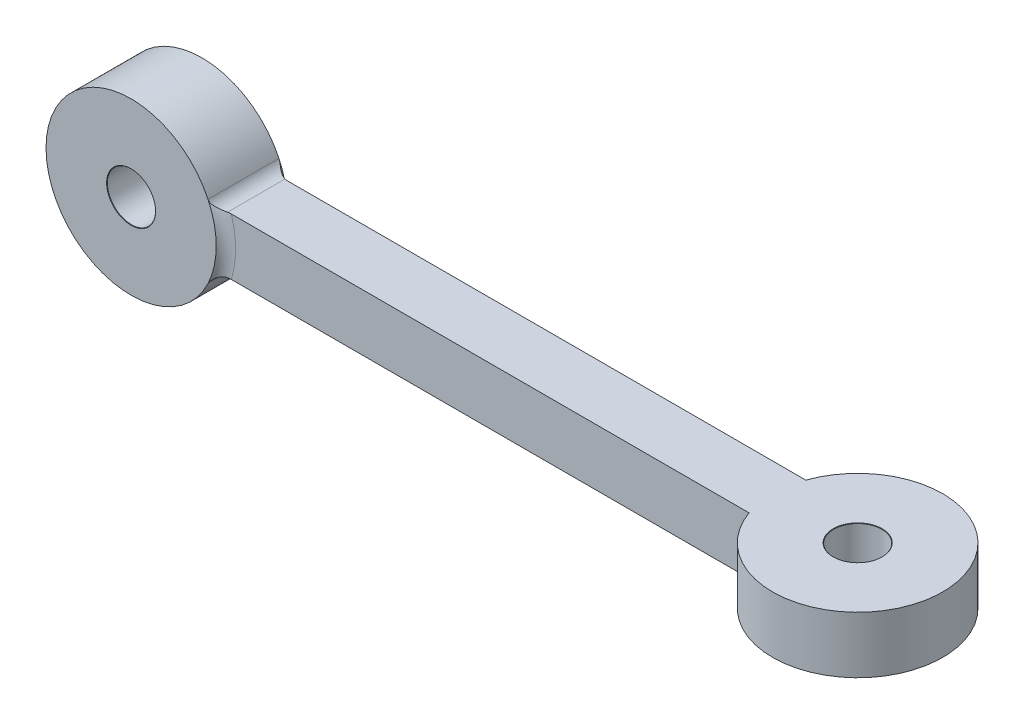
from build123d import *

# Parameters (mm, degrees)
BOSS_EXTRUDE10_DEPTH           = 2.5
BOSS_EXTRUDE10_DEPTH_BACK      = 2.5
SKETCH7_R                      = 6
BOSS_EXTRUDE11_DEPTH           = 2
BOSS_EXTRUDE11_DEPTH_BACK      = 2
FILLET4_R                      = 1
M3_CLEARANCE_HOLE1_D           = 3.4
M3_CLEARANCE_HOLE1_CSINK_D     = 3.45
M3_CLEARANCE_HOLE1_CSINK_ANGLE = 90
M3_CLEARANCE_HOLE2_D           = 3.4
M3_CLEARANCE_HOLE2_CSINK_D     = 3.45
M3_CLEARANCE_HOLE2_CSINK_ANGLE = 90


with BuildPart() as part:
    # Sketch7 → Boss-Extrude10 (new, two sides: drawn at the far end of the back side and taken through both)
    with BuildSketch(Plane.XY.offset(-2).offset(-BOSS_EXTRUDE10_DEPTH_BACK)):
        with Locations((-3, 0)):
            Circle(SKETCH7_R)
    extrude(amount=BOSS_EXTRUDE10_DEPTH + BOSS_EXTRUDE10_DEPTH_BACK)

    # Sketch4 → Boss-Extrude11 (add, two sides: drawn at the far end of the back side and taken through both)
    with BuildSketch(Plane(origin=(0, 0, 0), x_dir=(1, 0, 0), z_dir=(0, 1, 0)).offset(-BOSS_EXTRUDE11_DEPTH_BACK)):
        with BuildLine():
            ThreePointArc((40.062693756, 4), (39.719548005, 2), (40.062693756, 0))
            Line((40.062693756, 0), (45.719548005, 0))
            Line((45.719548005, 0), (45.719548005, 4))
            Line((45.719548005, 4), (40.062693756, 4))
        make_face()
        with BuildLine():
            Line((45.719548005, 0), (40.062693756, 0))
            ThreePointArc((40.062693756, 0), (46.734159878, -3.913591358), (51.719548005, 2))
            ThreePointArc((51.719548005, 2), (46.734159878, 7.913591358), (40.062693756, 4))
            Line((40.062693756, 4), (45.719548005, 4))
            Line((45.719548005, 4), (45.719548005, 0))
        make_face()
        with BuildLine():
            Line((0, 4), (0, 0))
            Line((0, 0), (40.062693756, 0))
            ThreePointArc((40.062693756, 0), (39.719548005, 2), (40.062693756, 4))
            Line((40.062693756, 4), (0, 4))
        make_face()
    extrude(amount=BOSS_EXTRUDE11_DEPTH + BOSS_EXTRUDE11_DEPTH_BACK)

    # Fillet4
    # the kernel refuses this fillet: 1 mm, written as the material it adds along each edge
    with BuildSketch(Plane(origin=(2.656854249, 2, 0), x_dir=(-0.381458859418171, 0.9243858169462511, 1.7363680755605478e-15), z_dir=(0, 0, -1)), Plane(origin=(2.656854249, -2, -4), x_dir=(-0.3814588594181449, -0.924385816946262, 1.7363680755604279e-15), z_dir=(0, 0, 1))) as fillet4_piece_1:
        with BuildLine():
            CenterArc((0.669685328, 0.998672259), FILLET4_R, 202.42407708, 64.623066475)
            Line((-0.254700489, 0.6172134), (-0.273188205, 0.609584223))
            Line((-0.273188205, 0.609584223), (-0.018487716, -0.007629177))
            Line((-0.018487716, -0.007629177), (0.001030285, -0.019973445))
            ThreePointArc((0.001030285, -0.019973445), (0.309085536, -0.012033556), (0.617140787, -0.019973445))
            Line((0.617140787, -0.019973445), (0.618171072, 0))
        make_face()
    extrude(amount=4)
    with BuildSketch(Plane(origin=(-3, 0, -4), x_dir=(0.764399035602867, -0.6447434484889372, 0), z_dir=(-0.6447434484889372, -0.764399035602867, 0))) as fillet4_piece_2_section:
        with BuildLine():
            CenterArc((6.866025404, -1), FILLET4_R, 90, 60)
            Line((6.866025404, 0), (6.866025404, 0.02))
            Line((6.866025404, 0.02), (6, 0.02))
            Line((6, 0.02), (5.98, 0))
            ThreePointArc((5.98, 0), (5.98, -0.25), (5.982679492, -0.49))
            Line((5.982679492, -0.49), (6, -0.5))
        make_face()
    fillet4_piece_2 = revolve(axis=Axis((-3, 0, -4), (0, 0, 1)), revolution_arc=40.146442844, mode=Mode.PRIVATE)
    fillet4_piece_2 = split(fillet4_piece_2, bisect_by=Plane(origin=(3.105396532, -2, -4.129597007), z_dir=(0, 1, 0)), keep=Keep.TOP, mode=Mode.PRIVATE)
    add(fillet4_piece_2)
    with BuildSketch(Plane(origin=(-3, 0, 0), x_dir=(0.7643990356028665, 0.6447434484889378, 0), z_dir=(-0.6447434484889378, 0.7643990356028665, 0))) as fillet4_piece_3_section:
        with BuildLine():
            CenterArc((6.866025404, -1), FILLET4_R, 90, 60)
            Line((6.866025404, 0), (6.866025404, 0.02))
            Line((6.866025404, 0.02), (6, 0.02))
            Line((6, 0.02), (5.98, 0))
            ThreePointArc((5.98, 0), (5.98, -0.25), (5.982679492, -0.49))
            Line((5.982679492, -0.49), (6, -0.5))
        make_face()
    fillet4_piece_3 = revolve(axis=Axis((-3, 0, 0), (0, 0, -1)), revolution_arc=40.146442844, mode=Mode.PRIVATE)
    fillet4_piece_3 = split(fillet4_piece_3, bisect_by=Plane(origin=(3.105396532, 2, 0.129597007), z_dir=(0, -1, 0)), keep=Keep.TOP, mode=Mode.PRIVATE)
    add(fillet4_piece_3)
    with BuildSketch(Plane(origin=(-3, 0, 0), x_dir=(1, 0, 0), z_dir=(0, 1, 0))) as fillet4_piece_4_section:
        with BuildLine():
            CenterArc((6.866025404, -1), FILLET4_R, 90, 60)
            Line((6.866025404, 0), (6.866025404, 0.02))
            Line((6.866025404, 0.02), (6, 0.02))
            Line((6, 0.02), (5.98, 0))
            ThreePointArc((5.98, 0), (5.98, -0.25), (5.982679492, -0.49))
            Line((5.982679492, -0.49), (6, -0.5))
        make_face()
    fillet4_piece_4 = revolve(axis=Axis((-3, 0, 0), (0, 0, -1)), revolution_arc=40.146442844, mode=Mode.PRIVATE)
    fillet4_piece_4 = split(fillet4_piece_4, bisect_by=Plane(origin=(3.105396981, -2, 0.129596926), z_dir=(0, 1, 0)), keep=Keep.TOP, mode=Mode.PRIVATE)
    add(fillet4_piece_4)
    with BuildSketch(Plane(origin=(-3, 0, -4), x_dir=(1, 0, 0), z_dir=(0, -1, 0))) as fillet4_piece_5_section:
        with BuildLine():
            CenterArc((6.866025404, -1), FILLET4_R, 90, 60)
            Line((6.866025404, 0), (6.866025404, 0.02))
            Line((6.866025404, 0.02), (6, 0.02))
            Line((6, 0.02), (5.98, 0))
            ThreePointArc((5.98, 0), (5.98, -0.25), (5.982679492, -0.49))
            Line((5.982679492, -0.49), (6, -0.5))
        make_face()
    fillet4_piece_5 = revolve(axis=Axis((-3, 0, -4), (0, 0, 1)), revolution_arc=40.146442844, mode=Mode.PRIVATE)
    fillet4_piece_5 = split(fillet4_piece_5, bisect_by=Plane(origin=(3.105396981, 2, -4.129596926), z_dir=(0, -1, 0)), keep=Keep.TOP, mode=Mode.PRIVATE)
    add(fillet4_piece_5)
    with BuildSketch(Plane(origin=(-3, 0, 0), x_dir=(0.7643990356028665, 0.6447434484889378, 0), z_dir=(-0.6447434484889378, 0.7643990356028665, 0))) as fillet4_piece_6a_section:
        with BuildLine():
            CenterArc((6.866025404, -1), FILLET4_R, 90, 60)
            Line((6.866025404, 0), (6.866025404, 0.02))
            Line((6.866025404, 0.02), (6, 0.02))
            Line((6, 0.02), (5.98, 0))
            ThreePointArc((5.98, 0), (5.98, -0.25), (5.982679492, -0.49))
            Line((5.982679492, -0.49), (6, -0.5))
        make_face()
    fillet4_piece_6a = revolve(axis=Axis((-3, 0, 0), (0, 0, -1)), revolution_arc=40.146442844, mode=Mode.PRIVATE)
    fillet4_piece_6a = split(fillet4_piece_6a, bisect_by=Plane(origin=(2.392166005, 2, 0.125287607), z_dir=(0, 1, 0)), keep=Keep.TOP, mode=Mode.PRIVATE)
    with BuildSketch(Plane(origin=(2.656854249, 2, 1.669252677), x_dir=(-0.38145885941817037, 0.9243858169462514, 1.7363680755605446e-15), z_dir=(0, 0, -1))) as fillet4_piece_6b_section:
        with BuildLine():
            CenterArc((0.669685328, 0.998672259), FILLET4_R, 202.42407708, 64.623066475)
            Line((-0.254700489, 0.6172134), (-0.273188205, 0.609584223))
            Line((-0.273188205, 0.609584223), (-0.018487716, -0.007629177))
            Line((-0.018487716, -0.007629177), (0.001030285, -0.019973445))
            ThreePointArc((0.001030285, -0.019973445), (0.309085536, -0.012033556), (0.617140787, -0.019973445))
            Line((0.617140787, -0.019973445), (0.618171072, 0))
        make_face()
    fillet4_piece_6b = extrude(amount=5.669252677, mode=Mode.PRIVATE)
    fillet4_piece_6b = split(fillet4_piece_6b, bisect_by=Plane(origin=(2.758670991, 2.124773094, 0.5), z_dir=(0, 0, -1)), keep=Keep.TOP, mode=Mode.PRIVATE)
    fillet4_piece_6b = split(fillet4_piece_6b, bisect_by=Plane(origin=(2.758670991, 2.124773094, 0), z_dir=(0, 0, 1)), keep=Keep.TOP, mode=Mode.PRIVATE)
    fillet4_piece_6 = fillet4_piece_6a & fillet4_piece_6b
    add(fillet4_piece_6)
    with BuildSketch(Plane(origin=(-3, 0, -4), x_dir=(1, 0, 0), z_dir=(0, -1, 0))) as fillet4_piece_7a_section:
        with BuildLine():
            CenterArc((6.866025404, -1), FILLET4_R, 90, 60)
            Line((6.866025404, 0), (6.866025404, 0.02))
            Line((6.866025404, 0.02), (6, 0.02))
            Line((6, 0.02), (5.98, 0))
            ThreePointArc((5.98, 0), (5.98, -0.25), (5.982679492, -0.49))
            Line((5.982679492, -0.49), (6, -0.5))
        make_face()
    fillet4_piece_7a = revolve(axis=Axis((-3, 0, -4), (0, 0, 1)), revolution_arc=40.146442844, mode=Mode.PRIVATE)
    fillet4_piece_7a = split(fillet4_piece_7a, bisect_by=Plane(origin=(2.392165487, 2, -4.125287706), z_dir=(0, 1, 0)), keep=Keep.TOP, mode=Mode.PRIVATE)
    with BuildSketch(Plane(origin=(2.656854249, 2, 0), x_dir=(-0.381458859418171, 0.9243858169462511, 1.7363680755605478e-15), z_dir=(0, 0, -1))) as fillet4_piece_7b_section:
        with BuildLine():
            CenterArc((0.669685328, 0.998672259), FILLET4_R, 202.42407708, 64.623066475)
            Line((-0.254700489, 0.6172134), (-0.273188205, 0.609584223))
            Line((-0.273188205, 0.609584223), (-0.018487716, -0.007629177))
            Line((-0.018487716, -0.007629177), (0.001030285, -0.019973445))
            ThreePointArc((0.001030285, -0.019973445), (0.309085536, -0.012033556), (0.617140787, -0.019973445))
            Line((0.617140787, -0.019973445), (0.618171072, 0))
        make_face()
    fillet4_piece_7b = extrude(amount=5.669252677, mode=Mode.PRIVATE)
    fillet4_piece_7b = split(fillet4_piece_7b, bisect_by=Plane(origin=(2.758670991, 2.124773094, -4.5), z_dir=(0, 0, 1)), keep=Keep.TOP, mode=Mode.PRIVATE)
    fillet4_piece_7b = split(fillet4_piece_7b, bisect_by=Plane(origin=(2.758670991, 2.124773094, -4), z_dir=(0, 0, -1)), keep=Keep.TOP, mode=Mode.PRIVATE)
    fillet4_piece_7 = fillet4_piece_7a & fillet4_piece_7b
    add(fillet4_piece_7)
    with BuildSketch(Plane(origin=(2.656854249, -2, -5.669252677), x_dir=(-0.38145885941816965, -0.9243858169462517, 1.7363680755605413e-15), z_dir=(0, 0, 1))) as fillet4_piece_8a_section:
        with BuildLine():
            CenterArc((0.669685328, 0.998672259), FILLET4_R, 202.42407708, 64.623066475)
            Line((-0.254700489, 0.6172134), (-0.273188205, 0.609584223))
            Line((-0.273188205, 0.609584223), (-0.018487716, -0.007629177))
            Line((-0.018487716, -0.007629177), (0.001030285, -0.019973445))
            ThreePointArc((0.001030285, -0.019973445), (0.309085536, -0.012033556), (0.617140787, -0.019973445))
            Line((0.617140787, -0.019973445), (0.618171072, 0))
        make_face()
    fillet4_piece_8a = extrude(amount=5.669252677, mode=Mode.PRIVATE)
    fillet4_piece_8a = split(fillet4_piece_8a, bisect_by=Plane(origin=(2.758670991, -2.124773094, -4.5), z_dir=(0, 0, 1)), keep=Keep.TOP, mode=Mode.PRIVATE)
    fillet4_piece_8a = split(fillet4_piece_8a, bisect_by=Plane(origin=(2.758670991, -2.124773094, -4), z_dir=(0, 0, -1)), keep=Keep.TOP, mode=Mode.PRIVATE)
    with BuildSketch(Plane(origin=(-3, 0, -4), x_dir=(0.764399035602867, -0.6447434484889372, 0), z_dir=(-0.6447434484889372, -0.764399035602867, 0))) as fillet4_piece_8b_section:
        with BuildLine():
            CenterArc((6.866025404, -1), FILLET4_R, 90, 60)
            Line((6.866025404, 0), (6.866025404, 0.02))
            Line((6.866025404, 0.02), (6, 0.02))
            Line((6, 0.02), (5.98, 0))
            ThreePointArc((5.98, 0), (5.98, -0.25), (5.982679492, -0.49))
            Line((5.982679492, -0.49), (6, -0.5))
        make_face()
    fillet4_piece_8b = revolve(axis=Axis((-3, 0, -4), (0, 0, 1)), revolution_arc=40.146442844, mode=Mode.PRIVATE)
    fillet4_piece_8b = split(fillet4_piece_8b, bisect_by=Plane(origin=(2.392166005, -2, -4.125287607), z_dir=(0, -1, 0)), keep=Keep.TOP, mode=Mode.PRIVATE)
    fillet4_piece_8 = fillet4_piece_8a & fillet4_piece_8b
    add(fillet4_piece_8)
    with BuildSketch(Plane(origin=(-3, 0, 0), x_dir=(1, 0, 0), z_dir=(0, 1, 0))) as fillet4_piece_9a_section:
        with BuildLine():
            CenterArc((6.866025404, -1), FILLET4_R, 90, 60)
            Line((6.866025404, 0), (6.866025404, 0.02))
            Line((6.866025404, 0.02), (6, 0.02))
            Line((6, 0.02), (5.98, 0))
            ThreePointArc((5.98, 0), (5.98, -0.25), (5.982679492, -0.49))
            Line((5.982679492, -0.49), (6, -0.5))
        make_face()
    fillet4_piece_9a = revolve(axis=Axis((-3, 0, 0), (0, 0, -1)), revolution_arc=40.146442844, mode=Mode.PRIVATE)
    fillet4_piece_9a = split(fillet4_piece_9a, bisect_by=Plane(origin=(2.392165487, -2, 0.125287706), z_dir=(0, -1, 0)), keep=Keep.TOP, mode=Mode.PRIVATE)
    with BuildSketch(Plane(origin=(2.656854249, -2, -4), x_dir=(-0.3814588594181449, -0.924385816946262, 1.7363680755604279e-15), z_dir=(0, 0, 1))) as fillet4_piece_9b_section:
        with BuildLine():
            CenterArc((0.669685328, 0.998672259), FILLET4_R, 202.42407708, 64.623066475)
            Line((-0.254700489, 0.6172134), (-0.273188205, 0.609584223))
            Line((-0.273188205, 0.609584223), (-0.018487716, -0.007629177))
            Line((-0.018487716, -0.007629177), (0.001030285, -0.019973445))
            ThreePointArc((0.001030285, -0.019973445), (0.309085536, -0.012033556), (0.617140787, -0.019973445))
            Line((0.617140787, -0.019973445), (0.618171072, 0))
        make_face()
    fillet4_piece_9b = extrude(amount=5.669252677, mode=Mode.PRIVATE)
    fillet4_piece_9b = split(fillet4_piece_9b, bisect_by=Plane(origin=(2.758670991, -2.124773094, 0.5), z_dir=(0, 0, -1)), keep=Keep.TOP, mode=Mode.PRIVATE)
    fillet4_piece_9b = split(fillet4_piece_9b, bisect_by=Plane(origin=(2.758670991, -2.124773094, 0), z_dir=(0, 0, 1)), keep=Keep.TOP, mode=Mode.PRIVATE)
    fillet4_piece_9 = fillet4_piece_9a & fillet4_piece_9b
    add(fillet4_piece_9)

    # M3 Clearance Hole1 (through all)
    with Locations(Plane.XY.offset(0.5)):
        with Locations((-3, 0)):
            CounterSinkHole(M3_CLEARANCE_HOLE1_D / 2, M3_CLEARANCE_HOLE1_CSINK_D / 2, counter_sink_angle=M3_CLEARANCE_HOLE1_CSINK_ANGLE)

    # M3 Clearance Hole2 (through all)
    with Locations(Plane(origin=(0, 2, 0), x_dir=(1, 0, 0), z_dir=(0, 1, 0))):
        with Locations((45.719548005, 2)):
            CounterSinkHole(M3_CLEARANCE_HOLE2_D / 2, M3_CLEARANCE_HOLE2_CSINK_D / 2, counter_sink_angle=M3_CLEARANCE_HOLE2_CSINK_ANGLE)


solid = part.part
